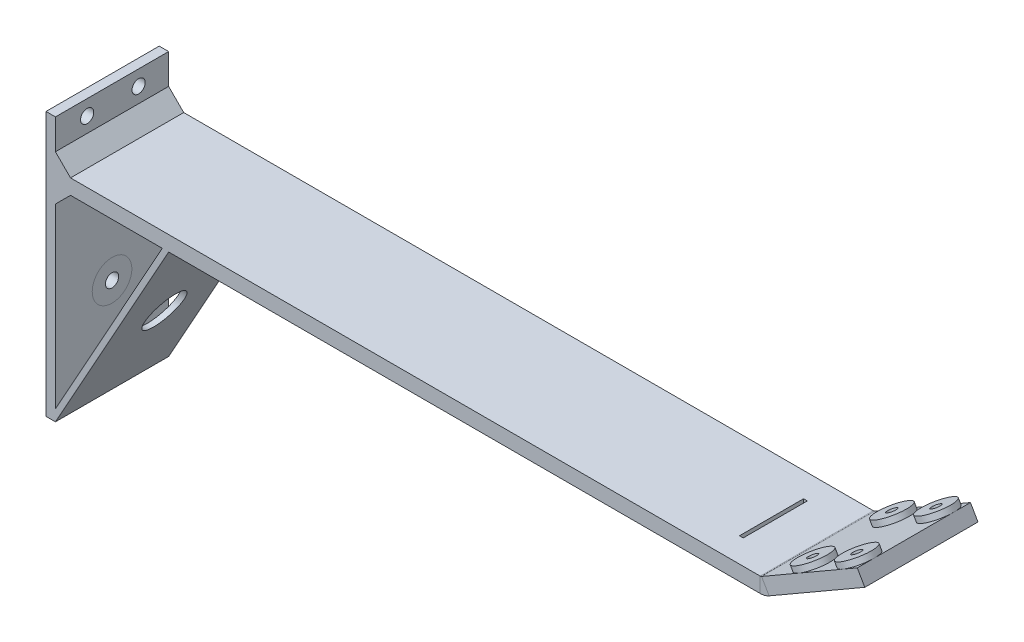
from build123d import *

# Parameters (mm, degrees)
ESQUISSE2_W                 = 220
ESQUISSE2_H                 = 30
T_LE_DE_BASE_PLI_E1_DEPTH   = 4
PLI_START                   = -15
PLI_ESQUISS_1_DEPTH         = 30
PLI_ESQUISS_1_2_DEPTH       = 30
ESQUISSE9_R                 = 4.5
ESQUISSE9_R_2               = 1.25
BOSS_EXTRU_1_DEPTH          = 1.5
ENL_V_START                 = -4
ENL_V_MAT_EXTRU_1_OUTLINE_R = 1.25
ENL_V_MAT_EXTRU_1_DEPTH     = 4
BOSS_EXTRU_2_DEPTH          = 12
BOSS_EXTRU_2_DEPTH_BACK     = 58
ESQUISSE11_W                = 2.5
ESQUISSE11_H                = 30
BOSS_EXTRU_3_DEPTH          = 3
ESQUISSE13_R                = 2
ENL_V_MAT_EXTRU_2_DEPTH     = 1.5
ENL_V_MAT_EXTRU_3_REACH     = 127.256
ESQUISSE14_W                = 1
ESQUISSE14_H                = 17
ESQUISSE12_R                = 1.75
ENL_V_MAT_EXTRU_4_DEPTH     = 223.720608774
ESQUISSE12_7_R              = 5.25
ESQUISSE12_7_R_2            = 1.75
ENL_V_MAT_EXTRU_5_DEPTH     = 223.720608774
BOSS_EXTRU_4_START          = -15
BOSS_EXTRU_4_DEPTH          = 30


# Read off the part's stored shape, not the designer's step: Pli esquissé1, Enlèv. mat.-Extru.1, Boss.-Extru.4
# Sheet-metal steps are written as plain solids
with BuildPart() as part:
    # Esquisse2 → Tôle de base pliée1 (new body)
    with BuildSketch(Plane(origin=(0, 0, 0), x_dir=(1, 0, 0), z_dir=(0, 1, 0))):
        Rectangle(ESQUISSE2_W, ESQUISSE2_H)
    extrude(amount=-T_LE_DE_BASE_PLI_E1_DEPTH)

    # Pli esquissé1 outline → Pli esquissé1 (cut)
    with BuildSketch(Plane.XY.offset(PLI_START)):
        with BuildLine():
            Line((110, 0), (87.480931171, 0))
            Line((87.480931171, 0), (81.651859795, -3.365415928))
            ThreePointArc((81.651859795, -3.365415928), (80.509482084, -3.838604269), (79.283559795, -4))
            Line((79.283559795, -4), (110, -4))
            Line((110, -4), (110, 0))
        make_face()
    extrude(amount=PLI_ESQUISS_1_DEPTH, mode=Mode.SUBTRACT)

    # Pli esquiss_1 2 outline → Pli esquiss_1 2 (add)
    with BuildSketch(Plane.XY.offset(PLI_START)):
        with BuildLine():
            Line((87.480931171, 0), (107.012166491, 11.27636397))
            Line((107.012166491, 11.27636397), (105.012166491, 14.740465585))
            Line((105.012166491, 14.740465585), (79.651859795, 0.098685688))
            ThreePointArc((79.651859795, 0.098685688), (79.474205904, 0.025099036), (79.283559795, 0))
            Line((79.283559795, 0), (87.480931171, 0))
        make_face()
    extrude(amount=PLI_ESQUISS_1_2_DEPTH)

    # Esquisse9 → Boss.-Extru.1 (add)
    # profile 1 of 4: a face of its own
    with BuildSketch(Plane(origin=(19.870232793, -34.416252755, 0), x_dir=(0.8660254037844382, 0.5000000000000011, 0), z_dir=(-0.5000000000000011, 0.8660254037844382, 0))):
        with Locations(Location((80.313436681, 10.5, 0), (0, 0, 90))):
            Circle(ESQUISSE9_R)
        with Locations(Location((80.313436681, 10.5, 0), (0, 0, 180))):
            Circle(ESQUISSE9_R_2, mode=Mode.SUBTRACT)
    # profile 2 of 4: a face of its own
    with BuildSketch(Plane(origin=(19.870232793, -34.416252755, 0), x_dir=(0.8660254037844382, 0.5000000000000011, 0), z_dir=(-0.5000000000000011, 0.8660254037844382, 0))):
        with Locations((93.813436681, 10.5)):
            Circle(ESQUISSE9_R)
        with Locations(Location((93.813436681, 10.5, 0), (0, 0, 180))):
            Circle(ESQUISSE9_R_2, mode=Mode.SUBTRACT)
    # profile 3 of 4: a face of its own
    with BuildSketch(Plane(origin=(19.870232793, -34.416252755, 0), x_dir=(0.8660254037844382, 0.5000000000000011, 0), z_dir=(-0.5000000000000011, 0.8660254037844382, 0))):
        with Locations((93.813436681, -10.5)):
            Circle(ESQUISSE9_R)
        with Locations((93.813436681, -10.5)):
            Circle(ESQUISSE9_R_2, mode=Mode.SUBTRACT)
    # profile 4 of 4: a face of its own
    with BuildSketch(Plane(origin=(19.870232793, -34.416252755, 0), x_dir=(0.8660254037844382, 0.5000000000000011, 0), z_dir=(-0.5000000000000011, 0.8660254037844382, 0))):
        with Locations((80.313436681, -10.5)):
            Circle(ESQUISSE9_R)
        with Locations((80.313436681, -10.5)):
            Circle(ESQUISSE9_R_2, mode=Mode.SUBTRACT)
    extrude(amount=BOSS_EXTRU_1_DEPTH)

    # Enlèv. mat.-Extru.1 outline → Enlèv. mat.-Extru.1 (cut)
    with BuildSketch(Plane(origin=(19.870232793, -34.416252755, 0), x_dir=(0.8660254037844382, 0.5000000000000011, 0), z_dir=(-0.5000000000000011, 0.8660254037844382, 0)).offset(ENL_V_START)):
        with Locations((93.813436681, 10.5)):
            Circle(ENL_V_MAT_EXTRU_1_OUTLINE_R)
        with Locations((93.813436681, -10.5)):
            Circle(ENL_V_MAT_EXTRU_1_OUTLINE_R)
        with Locations((80.313436681, 10.5)):
            Circle(ENL_V_MAT_EXTRU_1_OUTLINE_R)
        with Locations((80.313436681, -10.5)):
            Circle(ENL_V_MAT_EXTRU_1_OUTLINE_R)
    extrude(amount=ENL_V_MAT_EXTRU_1_DEPTH, mode=Mode.SUBTRACT)

    # Esquisse11 → Boss.-Extru.2 (add, two sides: drawn at the far end of the back side and taken through both)
    with BuildSketch(Plane(origin=(0, 0, 0), x_dir=(1, 0, 0), z_dir=(0, 1, 0)).offset(-BOSS_EXTRU_2_DEPTH_BACK)):
        with Locations((-108.75, 0)):
            Rectangle(ESQUISSE11_W, ESQUISSE11_H)
    extrude(amount=BOSS_EXTRU_2_DEPTH + BOSS_EXTRU_2_DEPTH_BACK)

    # Esquisse3D1 → Boss.-Extru.3 (add, along a direction that is not the sketch's normal)
    with BuildSketch(Plane(origin=(-107.5, -58, -15), x_dir=(0.43685202833051884, 0.7863336509949341, 0.43685202833051917), z_dir=(0.8741572761215378, -0.4856429311786321, 0))):
        Polygon((0, 0), (13.10556085, 26.98600146), (68.673138854, 0), (55.567578004, -26.98600146), align=None)
    extrude(amount=-BOSS_EXTRU_3_DEPTH, dir=(0, -1, 0))

    # Esquisse13 → Enlèv. mat.-Extru.2 (cut)
    with BuildSketch(Plane(origin=(21.870232793, -37.88035437, 0), x_dir=(0.8660254037844382, 0.500000000000001, 0), z_dir=(0.500000000000001, -0.8660254037844382, 0))):
        with Locations((93.813436681, 10.5)):
            Circle(ESQUISSE13_R)
        with Locations((93.813436681, -10.5)):
            Circle(ESQUISSE13_R)
        with Locations((80.313436681, -10.5)):
            Circle(ESQUISSE13_R)
        with Locations((80.313436681, 10.5)):
            Circle(ESQUISSE13_R)
    extrude(amount=-ENL_V_MAT_EXTRU_2_DEPTH, mode=Mode.SUBTRACT)

    # Esquisse14 → Enlèv. mat.-Extru.3 (cut, up to next)
    with BuildSketch(Plane(origin=(0, 0, 0), x_dir=(1, 0, 0), z_dir=(0, 1, 0)), mode=Mode.PRIVATE) as enl_v_mat_extru_3_sk1:
        with Locations((67.783559795, 0)):
            Rectangle(ESQUISSE14_W, ESQUISSE14_H)
    enl_v_mat_extru_3_tool1 = extrude(enl_v_mat_extru_3_sk1.sketch, amount=-ENL_V_MAT_EXTRU_3_REACH, mode=Mode.PRIVATE) & part.part
    add(enl_v_mat_extru_3_tool1.solids().sort_by_distance((67.78356, 0, 0))[0], mode=Mode.SUBTRACT)

    # Esquisse12 → Enlèv. mat.-Extru.4 (cut, through all)
    with BuildSketch(Plane(origin=(-107.5, 0, 0), x_dir=(0, 0, -1), z_dir=(1, 0, 0))):
        with Locations((0, -33)):
            Circle(ESQUISSE12_R)
        with Locations((-6.598263909, 8)):
            Circle(ESQUISSE12_R)
        with Locations((7.051423878, 8)):
            Circle(ESQUISSE12_R)
    extrude(amount=-ENL_V_MAT_EXTRU_4_DEPTH, mode=Mode.SUBTRACT)

    # Esquisse12<7> → Enlèv. mat.-Extru.5 (cut, through all)
    # profile 1 of 2: a face of its own
    with BuildSketch(Plane(origin=(-107.5, 0, 0), x_dir=(0, 0, -1), z_dir=(1, 0, 0))):
        with Locations(Location((0, -33, 0), (0, 0, 270))):
            Circle(ESQUISSE12_7_R)
        with Locations((0, -33)):
            Circle(ESQUISSE12_7_R_2, mode=Mode.SUBTRACT)
    # profile 2 of 2: a face of its own
    with BuildSketch(Plane(origin=(-107.5, 0, 0), x_dir=(0, 0, -1), z_dir=(1, 0, 0))):
        with Locations(Location((0, -33, 0), (0, 0, 270))):
            Circle(ESQUISSE12_7_R)
    extrude(amount=ENL_V_MAT_EXTRU_5_DEPTH, mode=Mode.SUBTRACT)

    # Boss.-Extru.4 outline → Boss.-Extru.4 (add)
    with BuildSketch(Plane.XY.offset(BOSS_EXTRU_4_START)):
        Polygon((-107.5, -4), (-107.5, -8), (-103.5, -4), align=None)
        Polygon((-103.5, 0), (-107.5, 4), (-107.5, 0), align=None)
    extrude(amount=BOSS_EXTRU_4_DEPTH)


solid = part.part
